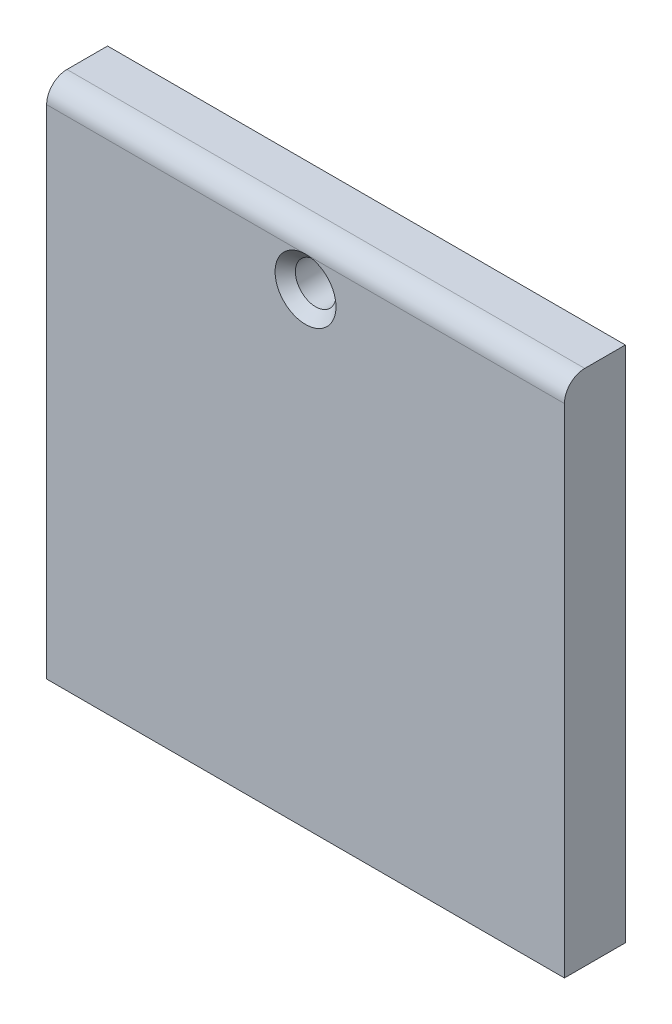
from build123d import *

# Parameters (mm, degrees)
ESBO_O1_W                = 51
ESBO_O1_H                = 51
RESSALTO_EXTRUS_O1_DEPTH = 6
ESBO_O2_W                = 36.5
ESBO_O2_H                = 6.5
CORTE_EXTRUS_O1_DEPTH    = 4.5
ESBO_O3_R                = 2
CORTE_EXTRUS_O2_DEPTH    = 37.558172821
ESBO_O4_W                = 44
ESBO_O4_H                = 30.5
CORTE_EXTRUS_O3_DEPTH    = 4.5
FILETE1_R                = 2
CHANFRO1_SIZE            = 1
RESSALTO_EXTRUS_O2_DEPTH = 2
RESSALTO_EXTRUS_O3_REACH = 56.245


with BuildPart() as part:
    # Esboço1 → Ressalto-extrusão1 (new body)
    with BuildSketch(Plane.XY):
        Rectangle(ESBO_O1_W, ESBO_O1_H)
    extrude(amount=RESSALTO_EXTRUS_O1_DEPTH)

    # Esboço2 → Corte-extrusão1 (cut)
    with BuildSketch(Plane(origin=(0, 0, 0), x_dir=(-1, 0, 0), z_dir=(0, 0, -1))):
        with Locations((0, -19.25)):
            Rectangle(ESBO_O2_W, ESBO_O2_H)
    extrude(amount=-CORTE_EXTRUS_O1_DEPTH, mode=Mode.SUBTRACT)

    # Esboço3 → Corte-extrusão2 (cut, through all)
    with BuildSketch(Plane.XY.offset(6)):
        with Locations((0, 20.5)):
            Circle(ESBO_O3_R)
    extrude(amount=-CORTE_EXTRUS_O2_DEPTH, mode=Mode.SUBTRACT)

    # Esboço4 → Corte-extrusão3 (cut)
    with BuildSketch(Plane(origin=(0, 0, 0), x_dir=(-1, 0, 0), z_dir=(0, 0, -1))):
        with Locations((0, 1.25)):
            Rectangle(ESBO_O4_W, ESBO_O4_H)
    extrude(amount=-CORTE_EXTRUS_O3_DEPTH, mode=Mode.SUBTRACT)

    # Filete1
    filete1_edges = [part.edges().sort_by_distance(p)[0] for p in [
        (0, 25.5, 6),
    ]]
    fillet(filete1_edges, radius=FILETE1_R)

    # Chanfro1
    chanfro1_edges = [part.edges().sort_by_distance(p)[0] for p in [
        (-2, 20.5, 6),
    ]]
    chamfer(chanfro1_edges, length=CHANFRO1_SIZE - 0.0001)  # a hair under: the kernel refuses the full size

    # Esboço5 → Ressalto-extrusão2 (add)
    with BuildSketch(Plane(origin=(0, 0, 0), x_dir=(-1, 0, 0), z_dir=(0, 0, -1))):
        Polygon((-23.5, 19.5), (-21.5, 19.5), (-21.5, 21.5), (-19.5, 21.5), (-19.5, 23.5), (-23.5, 23.5), align=None)
        Polygon((21.5, 19.5), (23.5, 19.5), (23.5, 23.5), (19.5, 23.5), (19.5, 21.5), (21.5, 21.5), align=None)
    extrude(amount=RESSALTO_EXTRUS_O2_DEPTH)

    # Ressalto-extrusão3: up to this face of the body (flat: up to its plane)
    ressalto_extrus_o3_end = Plane(part.part.faces().sort_by_distance((22, 1.25, 2.25))[0])
    # Esboço6 → Ressalto-extrusão3 (add, up to the picked face)
    with BuildSketch(Plane(origin=(-22, 0, 0), x_dir=(0, 0, -1), z_dir=(1, 0, 0)), mode=Mode.PRIVATE) as ressalto_extrus_o3_sk1:
        Polygon((0, -16), (2, -14), (0, -14), align=None)
    ressalto_extrus_o3_tool1 = split(extrude(ressalto_extrus_o3_sk1.sketch, amount=RESSALTO_EXTRUS_O3_REACH, mode=Mode.PRIVATE), bisect_by=ressalto_extrus_o3_end, keep=Keep.BOTH, mode=Mode.PRIVATE)
    # Esboço6 → Ressalto-extrusão3 (add, up to the picked face)
    with BuildSketch(Plane(origin=(-22, 0, 0), x_dir=(0, 0, -1), z_dir=(1, 0, 0)), mode=Mode.PRIVATE) as ressalto_extrus_o3_sk2:
        Polygon((-4.5, -1.5), (2, -1.5), (-4.5, -4), align=None)
    ressalto_extrus_o3_tool2 = split(extrude(ressalto_extrus_o3_sk2.sketch, amount=RESSALTO_EXTRUS_O3_REACH, mode=Mode.PRIVATE), bisect_by=ressalto_extrus_o3_end, keep=Keep.BOTH, mode=Mode.PRIVATE)
    # Esboço6 → Ressalto-extrusão3 (add, up to the picked face)
    with BuildSketch(Plane(origin=(-22, 0, 0), x_dir=(0, 0, -1), z_dir=(1, 0, 0)), mode=Mode.PRIVATE) as ressalto_extrus_o3_sk3:
        Polygon((-4.5, 8.5), (2, 11), (-4.5, 11), align=None)
    ressalto_extrus_o3_tool3 = split(extrude(ressalto_extrus_o3_sk3.sketch, amount=RESSALTO_EXTRUS_O3_REACH, mode=Mode.PRIVATE), bisect_by=ressalto_extrus_o3_end, keep=Keep.BOTH, mode=Mode.PRIVATE)
    add(ressalto_extrus_o3_tool1.solids().sort_by(Axis((-22, -14.666667, -0.666667), (1, 0, 0)))[0])
    add(ressalto_extrus_o3_tool2.solids().sort_by(Axis((-22, -2.333333, 2.333333), (1, 0, 0)))[0])
    add(ressalto_extrus_o3_tool3.solids().sort_by(Axis((-22, 10.166667, 2.333333), (1, 0, 0)))[0])


solid = part.part
